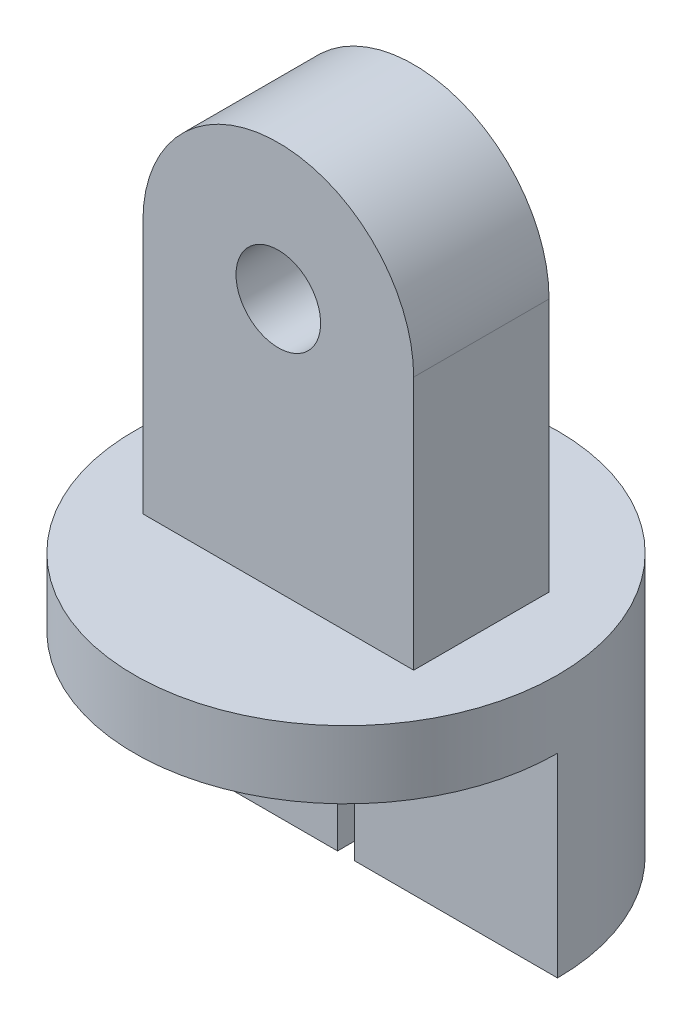
from build123d import *

# Parameters (mm, degrees)
BOSS_EXTRUDE2_DEPTH = 4
SKETCH4_R           = 2.5
CUT_EXTRUDE1_DEPTH  = 19.788294228
SKETCH6_R           = 12.5
BOSS_EXTRUDE3_DEPTH = 4
BOSS_EXTRUDE4_DEPTH = 1.5
BOSS_EXTRUDE5_DEPTH = 10
CUT_EXTRUDE2_REACH  = 44.364
SKETCH9_W           = 1
SKETCH9_H           = 7


with BuildPart() as part:
    # Sketch3 → Boss-Extrude2 (new, symmetric)
    with BuildSketch(Plane.XY):
        with BuildLine():
            Line((8, 0), (8, -15))
            Line((8, -15), (-8, -15))
            Line((-8, -15), (-8, 0))
            ThreePointArc((-8, 0), (0, 8), (8, 0))
        make_face()
    extrude(amount=BOSS_EXTRUDE2_DEPTH, both=True)

    # Sketch4 → Cut-Extrude1 (cut, through all)
    with BuildSketch(Plane(origin=(0, 0, -4), x_dir=(-1, 0, 0), z_dir=(0, 0, -1))):
        Circle(SKETCH4_R)
    extrude(amount=-CUT_EXTRUDE1_DEPTH, mode=Mode.SUBTRACT)

    # Sketch6 → Boss-Extrude3 (add)
    with BuildSketch(Plane.XZ.offset(15)):
        Circle(SKETCH6_R)
    extrude(amount=BOSS_EXTRUDE3_DEPTH)

    # Sketch7 → Boss-Extrude4 (add)
    with BuildSketch(Plane.XZ.offset(19)):
        with BuildLine():
            Line((-12.5, 0), (-10.5, 0))
            ThreePointArc((-10.5, 0), (0, -10.5), (10.5, 0))
            Line((10.5, 0), (12.5, 0))
            ThreePointArc((12.5, 0), (0, -12.5), (-12.5, 0))
        make_face()
    extrude(amount=BOSS_EXTRUDE4_DEPTH)

    # Sketch8 → Boss-Extrude5 (add)
    with BuildSketch(Plane.XZ.offset(20.5)):
        with BuildLine():
            Line((-12.5, 0), (12.5, 0))
            ThreePointArc((12.5, 0), (0, -12.5), (-12.5, 0))
        make_face()
    extrude(amount=BOSS_EXTRUDE5_DEPTH)

    # Sketch9 → Cut-Extrude2 (cut, up to next)
    with BuildSketch(Plane.XZ.offset(30.5), mode=Mode.PRIVATE) as cut_extrude2_sk1:
        with Locations((0, -3.5)):
            Rectangle(SKETCH9_W, SKETCH9_H)
    cut_extrude2_tool1 = extrude(cut_extrude2_sk1.sketch, amount=-CUT_EXTRUDE2_REACH, mode=Mode.PRIVATE) & part.part
    add(cut_extrude2_tool1.solids().sort_by_distance((0, -30.5, -3.5))[0], mode=Mode.SUBTRACT)


solid = part.part
